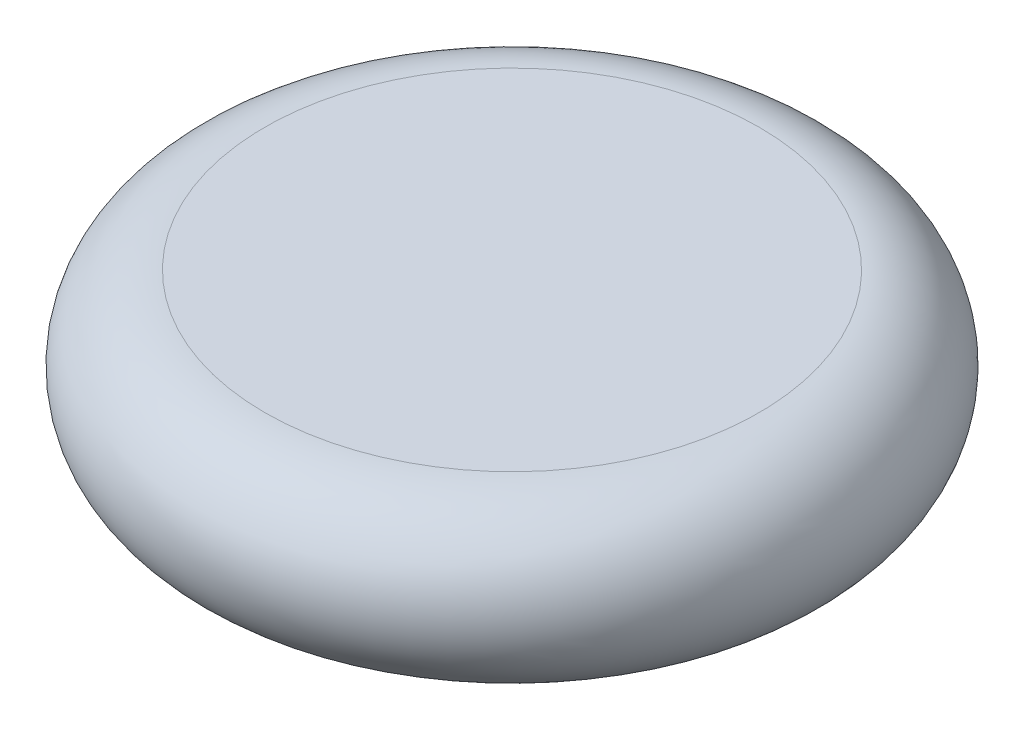
from build123d import *


with BuildPart() as part:
    # Sketch1 → Revolve2 (revolve)
    with BuildSketch(Plane.XY):
        with BuildLine():
            Line((0, 166.666666667), (0, -500))
            Line((0, -500), (1000, -500))
            ThreePointArc((1000, -500), (1333.333333333, -166.666666667), (1000, 166.666666667))
            Line((1000, 166.666666667), (0, 166.666666667))
        make_face()
    revolve(axis=Axis((0, 550, 0), (0, -1, 0)))


solid = part.part
